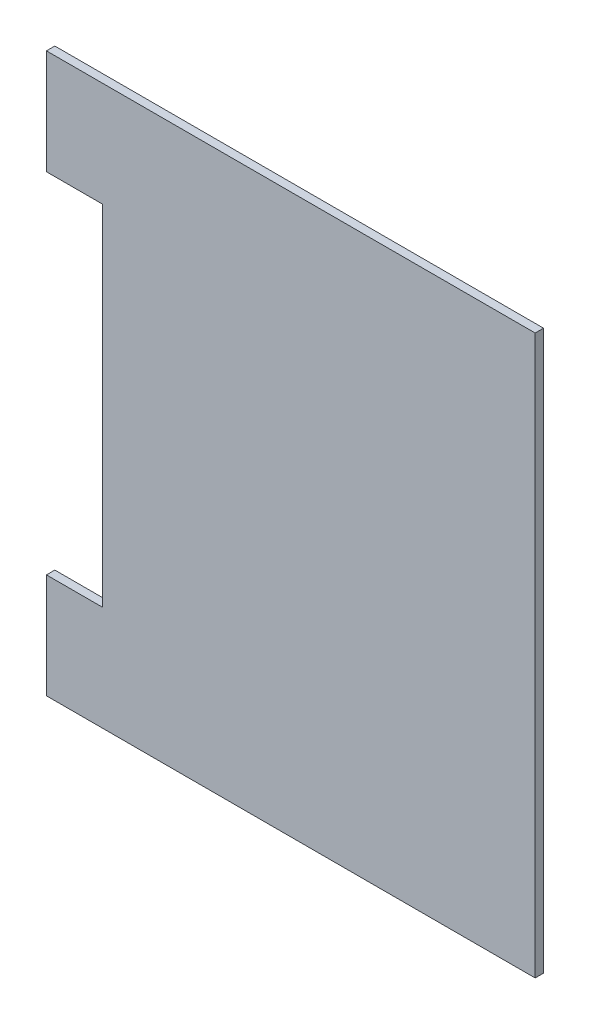
from build123d import *

# Parameters (mm, degrees)
SKETCH1_W           = 350
SKETCH1_H           = 400
BOSS_EXTRUDE1_DEPTH = 6
SKETCH2_W           = 40
SKETCH2_H           = 250
CUT_EXTRUDE1_DEPTH  = 10


with BuildPart() as part:
    # Sketch1 → Boss-Extrude1 (new body)
    with BuildSketch(Plane.XY):
        with Locations((146.428571429, 177.104761905)):
            Rectangle(SKETCH1_W, SKETCH1_H)
    extrude(amount=BOSS_EXTRUDE1_DEPTH)

    # Sketch2 → Cut-Extrude1 (cut)
    with BuildSketch(Plane.XY.offset(6)):
        with Locations((-8.571428571, 177.104761905)):
            Rectangle(SKETCH2_W, SKETCH2_H)
    extrude(amount=-CUT_EXTRUDE1_DEPTH, mode=Mode.SUBTRACT)


solid = part.part
